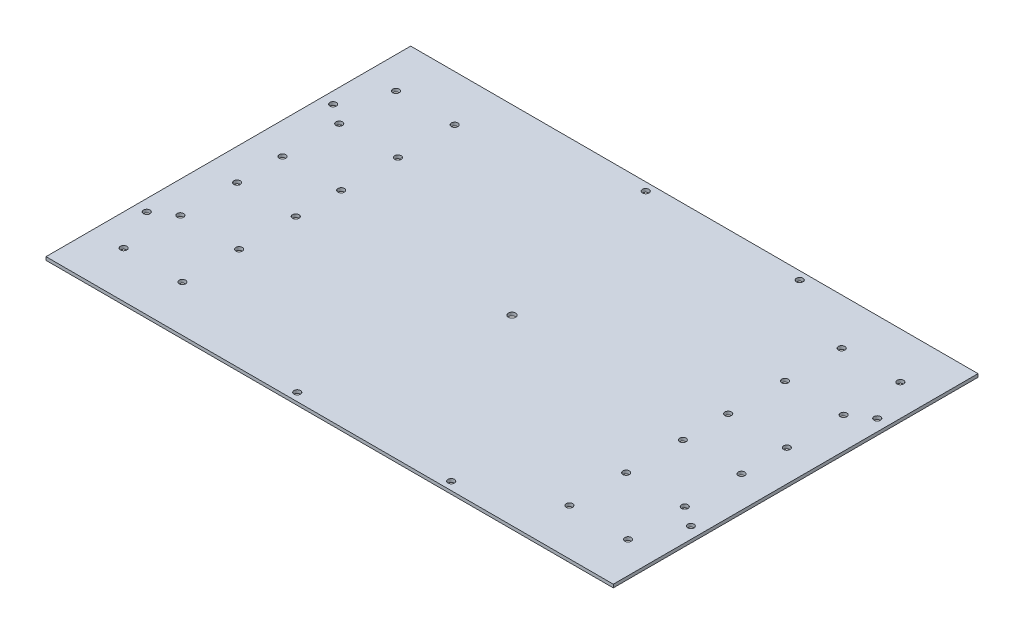
from build123d import *

# Parameters (mm, degrees)
SKETCH2_W               = 700
SKETCH2_H               = 450
BOSS_EXTRUDE1_DEPTH     = 2
SKETCH6_R               = 4
CUT_EXTRUDE2_DEPTH      = 417.10215092
CUT_EXTRUDE4_REACH      = 418.102
SKETCH8_R               = 4.5
SKETCH9_R               = 4
CUT_EXTRUDE5_DEPTH      = 417.10215092
CUT_EXTRUDE6_DEPTH      = 417.10215092
CUT_EXTRUDE6_DEPTH_BACK = 417.10215092
SKETCH10_R              = 4


with BuildPart() as part:
    # Sketch2 → Boss-Extrude1 (new, symmetric)
    with BuildSketch(Plane(origin=(0, 0, 0), x_dir=(1, 0, 0), z_dir=(0, 1, 0))):
        Rectangle(SKETCH2_W, SKETCH2_H)
    extrude(amount=BOSS_EXTRUDE1_DEPTH, both=True)

    # Sketch6 → Cut-Extrude2 (cut, through all)
    with BuildSketch(Plane(origin=(0, 2, 0), x_dir=(1, 0, 0), z_dir=(0, 1, 0))):
        with Locations((-311.203103448, 168)):
            Circle(SKETCH6_R)
        with Locations((-238.793103448, 168)):
            Circle(SKETCH6_R)
        with Locations((-238.793103448, 98)):
            Circle(SKETCH6_R)
        with Locations((-311.203103448, 98)):
            Circle(SKETCH6_R)
        with Locations((-311.203103448, 28)):
            Circle(SKETCH6_R)
        with Locations((-238.793103448, 28)):
            Circle(SKETCH6_R)
        with Locations((238.793103448, 168)):
            Circle(SKETCH6_R)
        with Locations((311.203103448, 168)):
            Circle(SKETCH6_R)
        with Locations((311.203103448, 98)):
            Circle(SKETCH6_R)
        with Locations((238.793103448, 98)):
            Circle(SKETCH6_R)
        with Locations((238.793103448, 28)):
            Circle(SKETCH6_R)
        with Locations((311.203103448, 28)):
            Circle(SKETCH6_R)
        with Locations((-311.203103448, -28)):
            Circle(SKETCH6_R)
        with Locations((-238.793103448, -28)):
            Circle(SKETCH6_R)
        with Locations((-238.793103448, -98)):
            Circle(SKETCH6_R)
        with Locations((-311.203103448, -98)):
            Circle(SKETCH6_R)
        with Locations((-311.203103448, -168)):
            Circle(SKETCH6_R)
        with Locations((-238.793103448, -168)):
            Circle(SKETCH6_R)
        with Locations((238.793103448, -28)):
            Circle(SKETCH6_R)
        with Locations((311.203103448, -28)):
            Circle(SKETCH6_R)
        with Locations((311.203103448, -98)):
            Circle(SKETCH6_R)
        with Locations((238.793103448, -98)):
            Circle(SKETCH6_R)
        with Locations((238.793103448, -168)):
            Circle(SKETCH6_R)
        with Locations((311.203103448, -168)):
            Circle(SKETCH6_R)
    extrude(amount=-CUT_EXTRUDE2_DEPTH, mode=Mode.SUBTRACT)

    # Sketch8 → Cut-Extrude4 (cut, up to next)
    with BuildSketch(Plane(origin=(0, 2, 0), x_dir=(1, 0, 0), z_dir=(0, 1, 0)), mode=Mode.PRIVATE) as cut_extrude4_sk1:
        Circle(SKETCH8_R)
    cut_extrude4_tool1 = extrude(cut_extrude4_sk1.sketch, amount=-CUT_EXTRUDE4_REACH, mode=Mode.PRIVATE) & part.part
    add(cut_extrude4_tool1.solids().sort_by_distance((0, 2, 0))[0], mode=Mode.SUBTRACT)

    # Sketch9 → Cut-Extrude5 (cut, through all)
    with BuildSketch(Plane(origin=(0, 2, 0), x_dir=(1, 0, 0), z_dir=(0, 1, 0))):
        with Locations((-50, -215)):
            Circle(SKETCH9_R)
        with Locations((140, -215)):
            Circle(SKETCH9_R)
        with Locations((-50, 215)):
            Circle(SKETCH9_R)
        with Locations((140, 215)):
            Circle(SKETCH9_R)
    extrude(amount=-CUT_EXTRUDE5_DEPTH, mode=Mode.SUBTRACT)

    # Sketch10 → Cut-Extrude6 (cut, two sides: drawn at the far end of the back side and taken through both)
    with BuildSketch(Plane(origin=(0, 2, 0), x_dir=(1, 0, 0), z_dir=(0, 1, 0)).offset(-CUT_EXTRUDE6_DEPTH_BACK)):
        with Locations((-335.68, 115)):
            Circle(SKETCH10_R)
        with Locations((-335.68, -115)):
            Circle(SKETCH10_R)
        with Locations((335.68, 115)):
            Circle(SKETCH10_R)
        with Locations((335.68, -115)):
            Circle(SKETCH10_R)
    extrude(amount=CUT_EXTRUDE6_DEPTH + CUT_EXTRUDE6_DEPTH_BACK, mode=Mode.SUBTRACT)


solid = part.part
